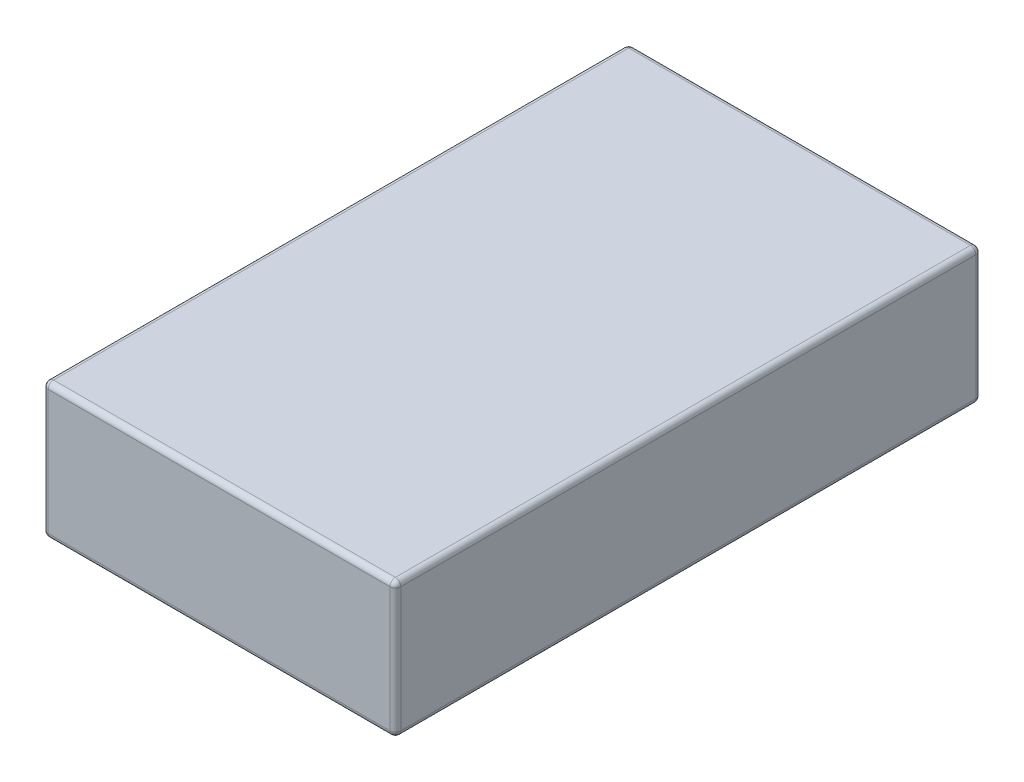
from build123d import *

# Parameters (mm, degrees)
SKETCH1_W           = 65
SKETCH1_H           = 108
BOSS_EXTRUDE1_DEPTH = 25
FILLET1_R           = 1


with BuildPart() as part:
    # Sketch1 → Boss-Extrude1 (new body)
    with BuildSketch(Plane(origin=(0, 0, 0), x_dir=(1, 0, 0), z_dir=(0, 1, 0))):
        Rectangle(SKETCH1_W, SKETCH1_H)
    extrude(amount=BOSS_EXTRUDE1_DEPTH)

    # Fillet1
    fillet1_edges = [part.edges().sort_by_distance(p)[0] for p in [
        (-32.5, 0, 0),
        (0, 0, -54),
        (32.5, 12.5, -54),
        (-32.5, 12.5, 54),
        (32.5, 25, 0),
        (0, 25, 54),
        (-32.5, 12.5, -54),
        (32.5, 12.5, 54),
        (-32.5, 25, 0),
        (0, 25, -54),
        (0, 0, 54),
        (32.5, 0, 0),
    ]]
    fillet(fillet1_edges, radius=FILLET1_R)


solid = part.part
